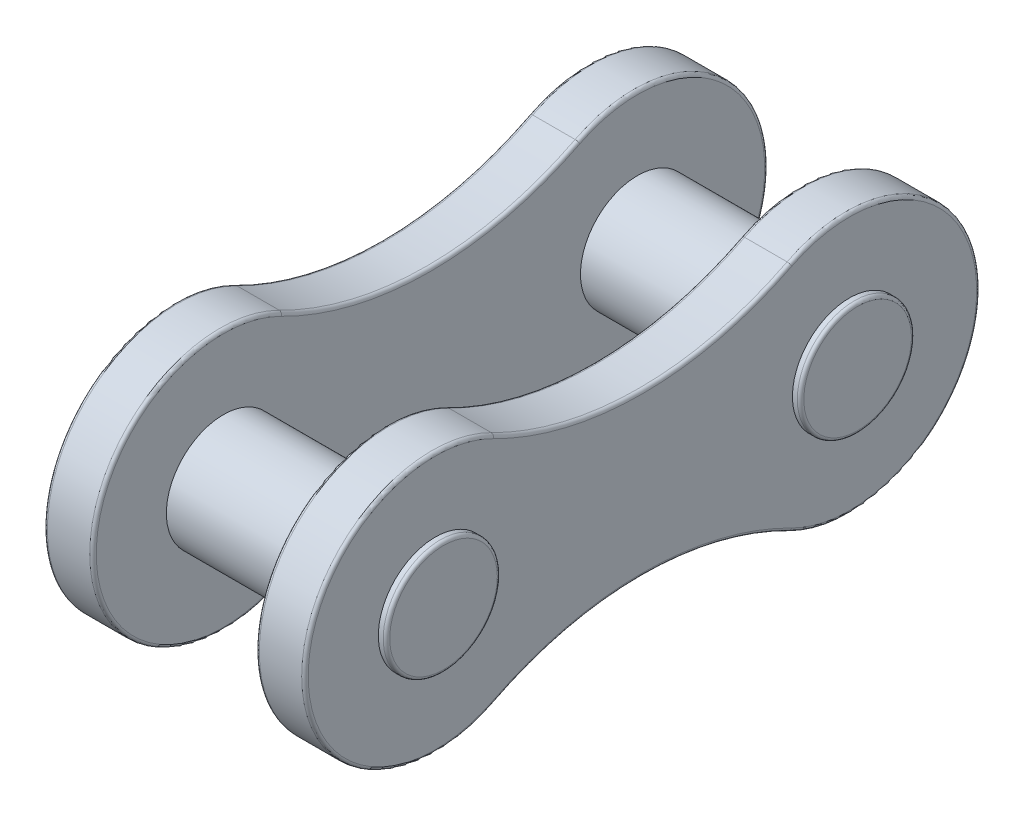
from build123d import *

# Parameters (mm, degrees)
BOSS_EXTRUDE2_START = 2.5
SKETCH5_R           = 1.75
BOSS_EXTRUDE2_DEPTH = 1.5
BOSS_EXTRUDE3_START = -2.5
SKETCH6_R           = 1.75
BOSS_EXTRUDE3_DEPTH = 1.5
SKETCH7_R           = 1.75
BOSS_EXTRUDE4_DEPTH = 4.25
FILLET1_R           = 0.1


with BuildPart() as part:
    # Sketch5 → Boss-Extrude2 (new body)
    with BuildSketch(Plane(origin=(0, 0, 0), x_dir=(0, 0, -1), z_dir=(1, 0, 0)).offset(BOSS_EXTRUDE2_START)):
        with BuildLine():
            ThreePointArc((-4.535714286, 3.56487971), (-10.35, 0), (-4.535714286, -3.56487971))
            ThreePointArc((-4.535714286, -3.56487971), (0, -2.477078985), (4.535714286, -3.56487971))
            ThreePointArc((4.535714286, -3.56487971), (10.35, 0), (4.535714286, 3.56487971))
            ThreePointArc((4.535714286, 3.56487971), (0, 2.477078985), (-4.535714286, 3.56487971))
        make_face()
        with Locations((-6.35, 0)):
            Circle(SKETCH5_R, mode=Mode.SUBTRACT)
        with Locations((6.35, 0)):
            Circle(SKETCH5_R, mode=Mode.SUBTRACT)
    extrude(amount=BOSS_EXTRUDE2_DEPTH)



with BuildPart() as body_2:
    # Sketch6 → Boss-Extrude3 (new body)
    with BuildSketch(Plane(origin=(0, 0, 0), x_dir=(0, 0, -1), z_dir=(1, 0, 0)).offset(BOSS_EXTRUDE3_START)):
        with BuildLine():
            ThreePointArc((-4.535714286, 3.56487971), (0, 2.477078985), (4.535714286, 3.56487971))
            ThreePointArc((4.535714286, 3.56487971), (10.35, 0), (4.535714286, -3.56487971))
            ThreePointArc((4.535714286, -3.56487971), (0, -2.477078985), (-4.535714286, -3.56487971))
            ThreePointArc((-4.535714286, -3.56487971), (-10.35, 0), (-4.535714286, 3.56487971))
        make_face()
        with Locations((6.35, 0)):
            Circle(SKETCH6_R, mode=Mode.SUBTRACT)
        with Locations((-6.35, 0)):
            Circle(SKETCH6_R, mode=Mode.SUBTRACT)
    extrude(amount=-BOSS_EXTRUDE3_DEPTH)


with BuildPart() as part_1:
    add(part.part)

    add(body_2.part)  # Boss-Extrude4 merges body 2
    # Sketch7 → Boss-Extrude4 (add, symmetric)
    with BuildSketch(Plane(origin=(0, 0, 0), x_dir=(0, 0, -1), z_dir=(1, 0, 0))):
        with Locations((6.35, 0)):
            Circle(SKETCH7_R)
        with Locations((-6.35, 0)):
            Circle(SKETCH7_R)
    extrude(amount=BOSS_EXTRUDE4_DEPTH, both=True)

    # Fillet1
    fillet1_edges = [part_1.edges().sort_by_distance(p)[0] for p in [
        (4, 0, -10.35),
        (4, -2.477078985, 0),
        (4, 0, 10.35),
        (2.5, 0, -10.35),
        (2.5, -2.477078985, 0),
        (2.5, 0, 10.35),
        (-4, 0, -10.35),
        (-4, -2.477078985, 0),
        (-4, 0, 10.35),
        (-2.5, 0, -10.35),
        (-2.5, -2.477078985, 0),
        (-2.5, 0, 10.35),
        (4, 2.477078985, 0),
        (2.5, 2.477078985, 0),
        (-4, 2.477078985, 0),
        (-2.5, 2.477078985, 0),
        (-4.25, 0, -4.6),
        (-4.25, 0, 8.1),
        (4.25, 0, -4.6),
        (4.25, 0, 8.1),
    ]]
    fillet(fillet1_edges, radius=FILLET1_R)


solid = part_1.part
